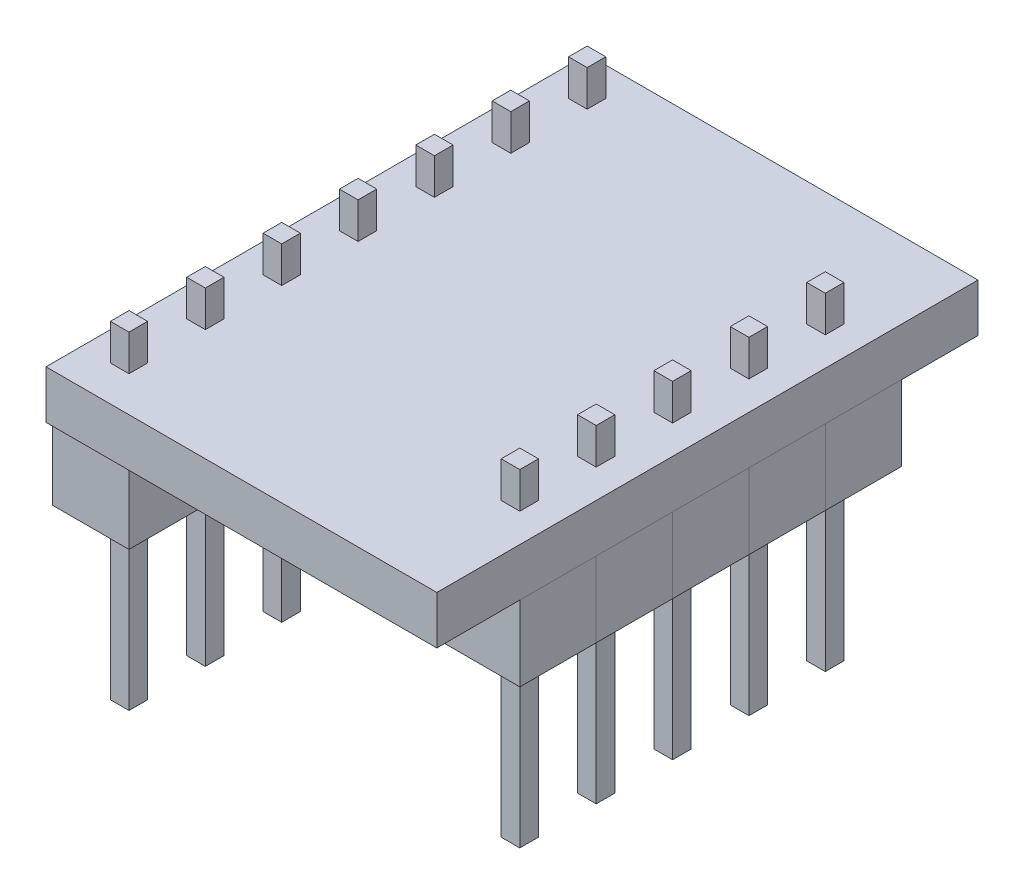
from build123d import *

# Parameters (mm, degrees)
SKETCH1_W              = 13
SKETCH1_H              = 18
BOSS_EXTRUDE1_DEPTH    = 1.6
SKETCH6_W              = 2.54
SKETCH6_H              = 2.54
BOSS_EXTRUDE2_DEPTH    = 2.5
BOSS_EXTRUDE3_START    = -5.3
SKETCH7_W              = 0.62
SKETCH7_H              = 0.62
BOSS_EXTRUDE3_DEPTH    = 10.9
LPATTERN1_START        = -8.1
LPATTERN1_OUTLINE_W    = 0.62
LPATTERN1_OUTLINE_H    = 0.62
LPATTERN1_DEPTH        = 10.9
LPATTERN1_2_OUTLINE_W  = 0.62
LPATTERN1_2_OUTLINE_H  = 0.62
LPATTERN1_2_DEPTH      = 10.9
LPATTERN1_3_OUTLINE_W  = 0.62
LPATTERN1_3_OUTLINE_H  = 0.62
LPATTERN1_3_DEPTH      = 10.9
LPATTERN1_4_OUTLINE_W  = 0.62
LPATTERN1_4_OUTLINE_H  = 0.62
LPATTERN1_4_DEPTH      = 10.9
LPATTERN1_5_OUTLINE_W  = 0.62
LPATTERN1_5_OUTLINE_H  = 0.62
LPATTERN1_5_DEPTH      = 10.9
LPATTERN1_6_OUTLINE_W  = 0.62
LPATTERN1_6_OUTLINE_H  = 0.62
LPATTERN1_6_DEPTH      = 10.9
LPATTERN1_START_2      = -6.5
LPATTERN1_7_OUTLINE_W  = 2.5
LPATTERN1_7_OUTLINE_H  = 2.54
LPATTERN1_7_DEPTH      = 2.54
LPATTERN1_8_OUTLINE_W  = 2.5
LPATTERN1_8_OUTLINE_H  = 2.54
LPATTERN1_8_DEPTH      = 2.54
LPATTERN1_9_OUTLINE_W  = 2.5
LPATTERN1_9_OUTLINE_H  = 2.54
LPATTERN1_9_DEPTH      = 2.54
LPATTERN1_10_OUTLINE_W = 2.5
LPATTERN1_10_OUTLINE_H = 2.54
LPATTERN1_10_DEPTH     = 2.54
LPATTERN1_11_OUTLINE_W = 2.5
LPATTERN1_11_OUTLINE_H = 2.54
LPATTERN1_11_DEPTH     = 2.54
LPATTERN1_12_OUTLINE_W = 2.5
LPATTERN1_12_OUTLINE_H = 2.54
LPATTERN1_12_DEPTH     = 2.54
LPATTERN2_START        = -2.5
LPATTERN2_OUTLINE_W    = 2.54
LPATTERN2_OUTLINE_H    = 2.54
LPATTERN2_DEPTH        = 2.5
LPATTERN2_START_2      = -8.1
LPATTERN2_2_OUTLINE_W  = 0.62
LPATTERN2_2_OUTLINE_H  = 0.62
LPATTERN2_2_DEPTH      = 10.9
LPATTERN3_COUNT        = 5
LPATTERN3_PITCH        = 2.54


# Read off the part's stored shape, not the designer's step: LPattern1, LPattern2
with BuildPart() as part:
    # Sketch1 → Boss-Extrude1 (new body)
    with BuildSketch(Plane(origin=(0, 0, 0), x_dir=(1, 0, 0), z_dir=(0, 1, 0))):
        Rectangle(SKETCH1_W, SKETCH1_H)
    extrude(amount=BOSS_EXTRUDE1_DEPTH)


with BuildPart() as body_2:
    # Sketch6 → Boss-Extrude2 (new body)
    with BuildSketch(Plane.XZ):
        with Locations((-5.23, -7.73)):
            Rectangle(SKETCH6_W, SKETCH6_H)
    extrude(amount=BOSS_EXTRUDE2_DEPTH)


with BuildPart() as body_3:
    # Sketch7 → Boss-Extrude3 (new body)
    with BuildSketch(Plane.XZ.offset(2.5).offset(BOSS_EXTRUDE3_START)):
        with Locations((-5.23, -7.73)):
            Rectangle(SKETCH7_W, SKETCH7_H)
    extrude(amount=BOSS_EXTRUDE3_DEPTH)


with BuildPart() as body_4:
    # LPattern1 outline → LPattern1 (new body)
    with BuildSketch(Plane(origin=(0, 0, 0), x_dir=(1, 0, 0), z_dir=(0, 1, 0)).offset(LPATTERN1_START)):
        with Locations((-5.23, -7.51)):
            Rectangle(LPATTERN1_OUTLINE_W, LPATTERN1_OUTLINE_H)
    extrude(amount=LPATTERN1_DEPTH)


with BuildPart() as body_5:
    # LPattern1 2 outline → LPattern1 2 (new body)
    with BuildSketch(Plane(origin=(0, 0, 0), x_dir=(1, 0, 0), z_dir=(0, 1, 0)).offset(LPATTERN1_START)):
        with Locations((-5.23, -4.97)):
            Rectangle(LPATTERN1_2_OUTLINE_W, LPATTERN1_2_OUTLINE_H)
    extrude(amount=LPATTERN1_2_DEPTH)


with BuildPart() as body_6:
    # LPattern1 3 outline → LPattern1 3 (new body)
    with BuildSketch(Plane(origin=(0, 0, 0), x_dir=(1, 0, 0), z_dir=(0, 1, 0)).offset(LPATTERN1_START)):
        with Locations((-5.23, -2.43)):
            Rectangle(LPATTERN1_3_OUTLINE_W, LPATTERN1_3_OUTLINE_H)
    extrude(amount=LPATTERN1_3_DEPTH)


with BuildPart() as body_7:
    # LPattern1 4 outline → LPattern1 4 (new body)
    with BuildSketch(Plane(origin=(0, 0, 0), x_dir=(1, 0, 0), z_dir=(0, 1, 0)).offset(LPATTERN1_START)):
        with Locations((-5.23, 0.11)):
            Rectangle(LPATTERN1_4_OUTLINE_W, LPATTERN1_4_OUTLINE_H)
    extrude(amount=LPATTERN1_4_DEPTH)


with BuildPart() as body_8:
    # LPattern1 5 outline → LPattern1 5 (new body)
    with BuildSketch(Plane(origin=(0, 0, 0), x_dir=(1, 0, 0), z_dir=(0, 1, 0)).offset(LPATTERN1_START)):
        with Locations((-5.23, 2.65)):
            Rectangle(LPATTERN1_5_OUTLINE_W, LPATTERN1_5_OUTLINE_H)
    extrude(amount=LPATTERN1_5_DEPTH)


with BuildPart() as body_9:
    # LPattern1 6 outline → LPattern1 6 (new body)
    with BuildSketch(Plane(origin=(0, 0, 0), x_dir=(1, 0, 0), z_dir=(0, 1, 0)).offset(LPATTERN1_START)):
        with Locations((-5.23, 5.19)):
            Rectangle(LPATTERN1_6_OUTLINE_W, LPATTERN1_6_OUTLINE_H)
    extrude(amount=LPATTERN1_6_DEPTH)


with BuildPart() as body_10:
    # LPattern1 7 outline → LPattern1 7 (new body)
    with BuildSketch(Plane.YZ.offset(LPATTERN1_START_2)):
        with Locations((-1.25, 7.51)):
            Rectangle(LPATTERN1_7_OUTLINE_W, LPATTERN1_7_OUTLINE_H)
    extrude(amount=LPATTERN1_7_DEPTH)


with BuildPart() as body_11:
    # LPattern1 8 outline → LPattern1 8 (new body)
    with BuildSketch(Plane.YZ.offset(LPATTERN1_START_2)):
        with Locations((-1.25, 4.97)):
            Rectangle(LPATTERN1_8_OUTLINE_W, LPATTERN1_8_OUTLINE_H)
    extrude(amount=LPATTERN1_8_DEPTH)


with BuildPart() as body_12:
    # LPattern1 9 outline → LPattern1 9 (new body)
    with BuildSketch(Plane.YZ.offset(LPATTERN1_START_2)):
        with Locations((-1.25, 2.43)):
            Rectangle(LPATTERN1_9_OUTLINE_W, LPATTERN1_9_OUTLINE_H)
    extrude(amount=LPATTERN1_9_DEPTH)


with BuildPart() as body_13:
    # LPattern1 10 outline → LPattern1 10 (new body)
    with BuildSketch(Plane.YZ.offset(LPATTERN1_START_2)):
        with Locations((-1.25, -0.11)):
            Rectangle(LPATTERN1_10_OUTLINE_W, LPATTERN1_10_OUTLINE_H)
    extrude(amount=LPATTERN1_10_DEPTH)


with BuildPart() as body_14:
    # LPattern1 11 outline → LPattern1 11 (new body)
    with BuildSketch(Plane.YZ.offset(LPATTERN1_START_2)):
        with Locations((-1.25, -2.65)):
            Rectangle(LPATTERN1_11_OUTLINE_W, LPATTERN1_11_OUTLINE_H)
    extrude(amount=LPATTERN1_11_DEPTH)


with BuildPart() as body_15:
    # LPattern1 12 outline → LPattern1 12 (new body)
    with BuildSketch(Plane.YZ.offset(LPATTERN1_START_2)):
        with Locations((-1.25, -5.19)):
            Rectangle(LPATTERN1_12_OUTLINE_W, LPATTERN1_12_OUTLINE_H)
    extrude(amount=LPATTERN1_12_DEPTH)


with BuildPart() as body_16:
    # LPattern2 outline → LPattern2 (new body)
    with BuildSketch(Plane(origin=(0, 0, 0), x_dir=(1, 0, 0), z_dir=(0, 1, 0)).offset(LPATTERN2_START)):
        with Locations((5.23, 5.19)):
            Rectangle(LPATTERN2_OUTLINE_W, LPATTERN2_OUTLINE_H)
    extrude(amount=LPATTERN2_DEPTH)


with BuildPart() as body_17:
    # LPattern2 2 outline → LPattern2 2 (new body)
    with BuildSketch(Plane(origin=(0, 0, 0), x_dir=(1, 0, 0), z_dir=(0, 1, 0)).offset(LPATTERN2_START_2)):
        with Locations((5.23, 5.19)):
            Rectangle(LPATTERN2_2_OUTLINE_W, LPATTERN2_2_OUTLINE_H)
    extrude(amount=LPATTERN2_2_DEPTH)


with BuildPart() as lpattern3_1:
    # LPattern3: pattern copy
    add(body_17.part.moved(Location(Vector(0, 0, 1) * (1 * LPATTERN3_PITCH))))


with BuildPart() as lpattern3_2:
    # LPattern3: pattern copy
    add(body_17.part.moved(Location(Vector(0, 0, 1) * (2 * LPATTERN3_PITCH))))


with BuildPart() as lpattern3_3:
    # LPattern3: pattern copy
    add(body_17.part.moved(Location(Vector(0, 0, 1) * (3 * LPATTERN3_PITCH))))


with BuildPart() as lpattern3_4:
    # LPattern3: pattern copy
    add(body_17.part.moved(Location(Vector(0, 0, 1) * (4 * LPATTERN3_PITCH))))


with BuildPart() as lpattern3_5:
    # LPattern3: pattern copy
    add(body_16.part.moved(Location(Vector(0, 0, 1) * (1 * LPATTERN3_PITCH))))


with BuildPart() as lpattern3_6:
    # LPattern3: pattern copy
    add(body_16.part.moved(Location(Vector(0, 0, 1) * (2 * LPATTERN3_PITCH))))


with BuildPart() as lpattern3_7:
    # LPattern3: pattern copy
    add(body_16.part.moved(Location(Vector(0, 0, 1) * (3 * LPATTERN3_PITCH))))


with BuildPart() as lpattern3_8:
    # LPattern3: pattern copy
    add(body_16.part.moved(Location(Vector(0, 0, 1) * (4 * LPATTERN3_PITCH))))


solid = Compound([part.part, body_2.part, body_3.part, body_4.part, body_5.part, body_6.part, body_7.part, body_8.part, body_9.part, body_10.part, body_11.part, body_12.part, body_13.part, body_14.part, body_15.part, body_16.part, body_17.part, lpattern3_1.part, lpattern3_2.part, lpattern3_3.part, lpattern3_4.part, lpattern3_5.part, lpattern3_6.part, lpattern3_7.part, lpattern3_8.part])
